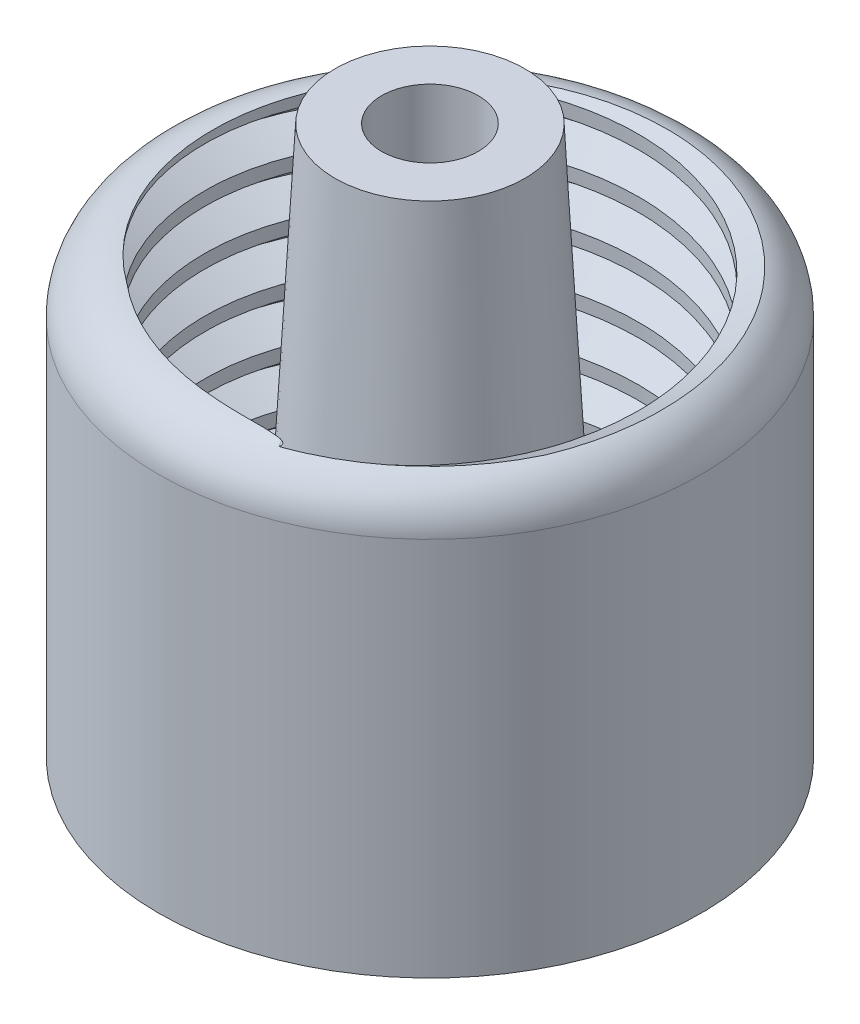
from build123d import *

# Parameters (mm, degrees)
SKETCH1_R           = 5
BOSS_EXTRUDE1_DEPTH = 8
SKETCH2_R           = 4
CUT_EXTRUDE1_DEPTH  = 5.4
SKETCH3_R           = 1.750000056
BOSS_EXTRUDE2_DEPTH = 7.500000122
SKETCH4_R           = 0.891017096
CUT_EXTRUDE2_DEPTH  = 12.834000122
FILLET4_R           = 1
DRAFT2_ANGLE        = 3
THREAD1_PITCH       = 1


with BuildPart() as part:
    # Sketch1 → Boss-Extrude1 (new body)
    with BuildSketch(Plane(origin=(0, 0, 0), x_dir=(1, 0, 0), z_dir=(0, 1, 0))):
        with Locations(Location((0, 0, 0), (0, 0, 270))):
            Circle(SKETCH1_R)
    extrude(amount=BOSS_EXTRUDE1_DEPTH)

    # Sketch2 → Cut-Extrude1 (cut)
    with BuildSketch(Plane(origin=(0, 8, 0), x_dir=(1, 0, 0), z_dir=(0, 1, 0))):
        with Locations(Location((0, 0, 0), (0, 0, 270))):
            Circle(SKETCH2_R)
    extrude(amount=-CUT_EXTRUDE1_DEPTH, mode=Mode.SUBTRACT)

    # Sketch3 → Boss-Extrude2 (add)
    with BuildSketch(Plane(origin=(0, 2.6, 0), x_dir=(1, 0, 0), z_dir=(0, 1, 0))):
        with Locations(Location((0, 0, 0), (0, 0, 270))):
            Circle(SKETCH3_R)
    extrude(amount=BOSS_EXTRUDE2_DEPTH)

    # Sketch4 → Cut-Extrude2 (cut)
    with BuildSketch(Plane(origin=(0, 10.100000122, 0), x_dir=(1, 0, 0), z_dir=(0, 1, 0))):
        with Locations(Location((0, 0, 0), (0, 0, 270))):
            Circle(SKETCH4_R)
    extrude(amount=-CUT_EXTRUDE2_DEPTH, mode=Mode.SUBTRACT)

    # Fillet4
    fillet4_edges = [part.edges().sort_by_distance(p)[0] for p in [
        (0, 8, -5),
    ]]
    fillet(fillet4_edges, radius=FILLET4_R - 0.0001)  # a hair under: the kernel refuses the full size

    # Draft2
    draft2_faces = [part.faces().sort_by_distance(p)[0] for p in [
        (0, 6.350000061, -1.750000056),
    ]]
    draft(draft2_faces, Plane.ZX.offset(10.100000122), DRAFT2_ANGLE)

    # Thread1: the profile of Thread Profile1 profile screwed along a right-hand helix of 10 turns, 8 arcs to a turn; built about Z, then put on its axis
    thread1_z = Axis((0, 0, 0), (0, 0, 1))
    thread1_corners = [(3.9997, 0, -0.000173205), (4.541265875, 0, 0.312499999), (4.541265875, 0, 0.437499999), (3.9997, 0, 0.750173202)]
    with BuildLine(mode=Mode.PRIVATE) as thread1_profile:
        Line(thread1_corners[0], thread1_corners[1])
        Line(thread1_corners[1], thread1_corners[2])
        Line(thread1_corners[2], thread1_corners[3])
        Line(thread1_corners[3], thread1_corners[0])
    thread1_cap = Face(thread1_profile.wire())
    thread1_turn_angles = [0, 22.5, 45, 67.5, 90, 112.5, 135, 157.5, 180, 202.5, 225, 247.5, 270, 292.5, 315, 337.5, 360]
    thread1_turn_weights = [1, 0.9238795325112867, 1, 0.9238795325112867, 1, 0.9238795325112867, 1, 0.9238795325112867, 1, 0.9238795325112867, 1, 0.9238795325112867, 1, 0.9238795325112867, 1, 0.9238795325112867, 1]
    thread1_turn_rails = [Edge.make_bspline([Vector(p[0], p[1], 0).rotate(thread1_z, thread1_turn_angles[k]) / thread1_turn_weights[k] + Vector(0, 0, p[2] + THREAD1_PITCH * thread1_turn_angles[k] / 360) for k in range(17)], [0, 0, 0, 1, 1, 2, 2, 3, 3, 4, 4, 5, 5, 6, 6, 7, 7, 8, 8, 8], 2, thread1_turn_weights) for p in thread1_corners]
    thread1_turn_sides = [Face.make_surface_from_curves(thread1_turn_rails[p[0]], thread1_turn_rails[p[1]]) for p in [(0, 1), (1, 2), (2, 3), (3, 0)]]
    thread1 = Plane(origin=(0, 1.6, 0), x_dir=(1, 0, 0), z_dir=(0, 1, 0)) * Solid(Shell([*[p.moved(Location((0, 0, THREAD1_PITCH * i))) for i in range(10) for p in thread1_turn_sides], thread1_cap, thread1_cap.rotate(thread1_z, 3600).moved(Location((0, 0, THREAD1_PITCH * 3600 / 360)))]))
    add(thread1, mode=Mode.SUBTRACT)


solid = part.part
